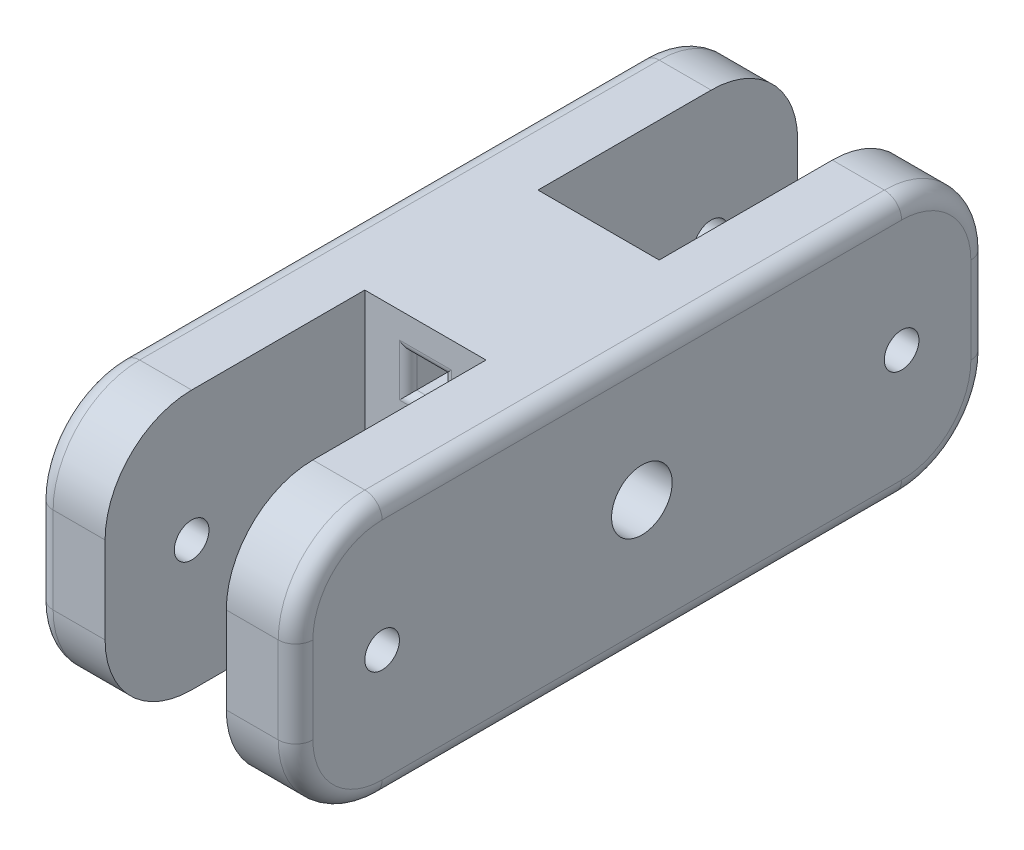
from build123d import *

# Parameters (mm, degrees)
BOTTOM_SECTION_BASE_SKETCH_W             = 15
BOTTOM_SECTION_BASE_SKETCH_H             = 15
BOTTOM_SECTION_EXTRUDE_DEPTH             = 40
HINGE_CUTOUT_SKETCH_W                    = 7
HINGE_CUTOUT_SKETCH_H                    = 15
HINGE_CUTOUT_EXTRUDED_CUT_DEPTH          = 15
HINGE_HOLE_SKETCH_R                      = 1
HINGE_HOLE_EXTRUDED_CUT_DEPTH            = 44.373378932
HINGER_CORNER_FILLETS_R                  = 5
STYLE_FILLETS_R                          = 1
ROUTING_HOLES_SKETCH_W                   = 2
ROUTING_HOLES_SKETCH_H                   = 2
ROUTING_HOLES_EXTRUDED_CUT_DEPTH         = 42.382363393
BACKING_START                            = -3.5
BACKING_EXTRUDE_DEPTH                    = 7
BOTTOM_SECTION_CONNECTION_HOLE_R         = 1.75
BOTTOM_SECTION_CONNECTION_HOLE_CUT_DEPTH = 3
SKETCH2_W                                = 7
SKETCH2_H                                = 2
BOTTOM_EXTENSION_EXTRUDE_DEPTH           = 6.5
FILLET1_R                                = 0.5


# Read off the part's stored shape, not the designer's step: Backing Extrude
with BuildPart() as part:
    # Bottom Section Base Sketch → Bottom Section Extrude (new body)
    with BuildSketch(Plane.XY):
        Rectangle(BOTTOM_SECTION_BASE_SKETCH_W, BOTTOM_SECTION_BASE_SKETCH_H)
    extrude(amount=BOTTOM_SECTION_EXTRUDE_DEPTH)

    # Hinge Cutout Sketch → Hinge Cutout Extruded Cut (cut)
    with BuildSketch(Plane.XY):
        Rectangle(HINGE_CUTOUT_SKETCH_W, HINGE_CUTOUT_SKETCH_H)
    hinge_cutout_extruded_cut = extrude(amount=HINGE_CUTOUT_EXTRUDED_CUT_DEPTH, mode=Mode.SUBTRACT)

    # Hinge Hole Sketch → Hinge Hole Extruded Cut (cut, through all)
    with BuildSketch(Plane(origin=(7.5, 0, 0), x_dir=(0, 0, -1), z_dir=(1, 0, 0))):
        with Locations((-5, 0)):
            Circle(HINGE_HOLE_SKETCH_R)
    hinge_hole_extruded_cut = extrude(amount=-HINGE_HOLE_EXTRUDED_CUT_DEPTH, mode=Mode.SUBTRACT)

    # Hinge and Hole Cutout Mirror: Hinge Cutout Extruded Cut, Hinge Hole Extruded Cut across plane
    add(hinge_cutout_extruded_cut.mirror(Plane.XY.offset(20)), mode=Mode.SUBTRACT)
    add(hinge_hole_extruded_cut.mirror(Plane.XY.offset(20)), mode=Mode.SUBTRACT)

    # Hinger Corner Fillets
    hinger_corner_fillets_edges = [part.edges().sort_by_distance(p)[0] for p in [
        (5.5, -7.5, 0),
        (-5.5, 7.5, 0),
        (-5.5, -7.5, 40),
        (-5.5, 7.5, 40),
        (5.5, -7.5, 40),
        (-5.5, -7.5, 0),
        (5.5, 7.5, 0),
        (5.5, 7.5, 40),
    ]]
    fillet(hinger_corner_fillets_edges, radius=HINGER_CORNER_FILLETS_R)

    # Style Fillets
    style_fillets_edges = [part.edges().sort_by_distance(p)[0] for p in [
        (7.5, 0, 40),
        (7.5, 7.5, 20),
        (-7.5, 7.5, 20),
        (7.5, 0, 0),
        (7.5, -7.5, 20),
        (7.5, 6.035533906, 1.464466094),
        (7.5, -6.035533906, 1.464466094),
        (7.5, -6.035533906, 38.535533906),
        (7.5, 6.035533906, 38.535533906),
        (-7.5, -7.5, 20),
        (-7.5, 0, 40),
        (-7.5, 0, 0),
        (-7.5, -6.035533906, 1.464466094),
        (-7.5, 6.035533906, 1.464466094),
        (-7.5, 6.035533906, 38.535533906),
        (-7.5, -6.035533906, 38.535533906),
    ]]
    fillet(style_fillets_edges, radius=STYLE_FILLETS_R)

    # Routing Holes Sketch → Routing Holes Extruded Cut (cut, through all)
    with BuildSketch(Plane.XY):
        with Locations((0, 4.5)):
            Rectangle(ROUTING_HOLES_SKETCH_W, ROUTING_HOLES_SKETCH_H)
        with Locations((0, -4.5)):
            Rectangle(ROUTING_HOLES_SKETCH_W, ROUTING_HOLES_SKETCH_H)
    extrude(amount=ROUTING_HOLES_EXTRUDED_CUT_DEPTH, mode=Mode.SUBTRACT)

    # Backing Extrude outline → Backing Extrude (add)
    with BuildSketch(Plane.YZ.offset(BACKING_START)):
        Polygon((-7.5, 29.963646865), (-7.5, 25), (-5.5, 25), (-5.5, 29.973325422), align=None)
    extrude(amount=BACKING_EXTRUDE_DEPTH)

    # Bottom Section Connection Hole → Bottom Section Connection Hole Cut (cut)
    with BuildSketch(Plane(origin=(7.5, 0, 0), x_dir=(0, 0, -1), z_dir=(1, 0, 0))):
        with Locations((-20, 0)):
            Circle(BOTTOM_SECTION_CONNECTION_HOLE_R)
    bottom_section_connection_hole_cut = extrude(amount=-BOTTOM_SECTION_CONNECTION_HOLE_CUT_DEPTH, mode=Mode.SUBTRACT)

    # Sketch2 → Bottom extension Extrude (add)
    with BuildSketch(Plane(origin=(0, 0, 15), x_dir=(-1, 0, 0), z_dir=(0, 0, -1))):
        with Locations((0, -6.5)):
            Rectangle(SKETCH2_W, SKETCH2_H)
    extrude(amount=BOTTOM_EXTENSION_EXTRUDE_DEPTH)

    # Connection Hole Mirror: Bottom Section Connection Hole Cut across plane
    add(bottom_section_connection_hole_cut.mirror(Plane(origin=(0, 0, 0), x_dir=(0, 0, 1), z_dir=(1, 0, 0))), mode=Mode.SUBTRACT)

    # Fillet1
    fillet1_edges = [part.edges().sort_by_distance(p)[0] for p in [
        (-1, -4.5, 25),
        (0, -3.5, 25),
        (1, -4.5, 25),
        (0, 5.5, 25),
        (1, 4.5, 25),
        (0, 3.5, 25),
        (-1, 4.5, 25),
        (-1, 4.5, 15),
        (0, 3.5, 15),
        (1, 4.5, 15),
        (0, 5.5, 15),
        (1, -4.5, 15),
        (0, -3.5, 15),
        (-1, -4.5, 15),
    ]]
    fillet(fillet1_edges, radius=FILLET1_R)


solid = part.part
